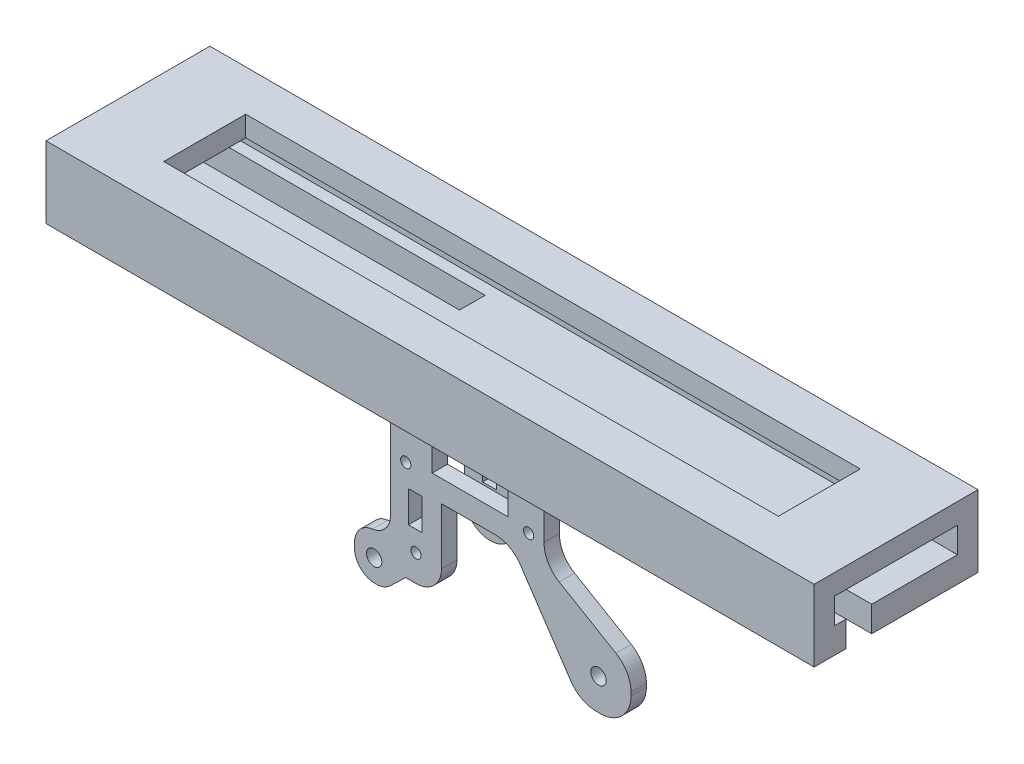
from build123d import *

# Parameters (mm, degrees)
SKETCH1_W            = 150
SKETCH1_H            = 32
BOSS_EXTRUDE1_DEPTH  = 5
SKETCH2_W            = 150
SKETCH2_H            = 4
BOSS_EXTRUDE2_DEPTH  = 9
SKETCH4_W            = 4
SKETCH4_H            = 4
BOSS_EXTRUDE3_DEPTH  = 150
SKETCH5_W            = 60
SKETCH5_H            = 5
CUT_EXTRUDE1_DEPTH   = 6
BOSS_EXTRUDE4_REACH  = 154.552
SKETCH6_W            = 15
SKETCH6_H            = 4
SKETCH7_W            = 60
SKETCH7_H            = 5
CUT_EXTRUDE2_DEPTH   = 6
SKETCH8_W            = 30
SKETCH8_H            = 3
BOSS_EXTRUDE5_DEPTH  = 16
SKETCH9_R            = 1
CUT_EXTRUDE3_DEPTH   = 153.867794188
SKETCH11_W           = 10
SKETCH11_H           = 3
BOSS_EXTRUDE7_DEPTH  = 16
SKETCH12_R           = 1
CUT_EXTRUDE4_DEPTH   = 156.359462216
SKETCH13_W           = 20
SKETCH13_H           = 3
BOSS_EXTRUDE8_DEPTH  = 20
SKETCH14_W           = 10
SKETCH14_H           = 3
BOSS_EXTRUDE9_DEPTH  = 4
SKETCH15_W           = 7
SKETCH15_H           = 3
BOSS_EXTRUDE10_DEPTH = 5
SKETCH16_R           = 1.5
CUT_EXTRUDE5_DEPTH   = 157.232399009
CUT_EXTRUDE6_DEPTH   = 5
CUT_EXTRUDE7_DEPTH   = 5
BOSS_EXTRUDE11_DEPTH = 3
CUT_EXTRUDE8_DEPTH   = 3
SKETCH21_W           = 14.847248178
SKETCH21_H           = 8.269274671
CUT_EXTRUDE9_DEPTH   = 157.232399009
FILLET3_R            = 6
FILLET4_R            = 4
FILLET5_R            = 5
FILLET6_R            = 5
SKETCH22_W           = 2.686432883
SKETCH22_H           = 6.135326584
CUT_EXTRUDE10_DEPTH  = 157.232399009
FILLET7_R            = 6
FILLET8_R            = 6
FILLET9_R            = 4
FILLET10_R           = 1
FILLET11_R           = 1


with BuildPart() as part:
    # Sketch1 → Boss-Extrude1 (new body)
    with BuildSketch(Plane(origin=(0, 0, 0), x_dir=(1, 0, 0), z_dir=(0, 1, 0))):
        with Locations((75, -16)):
            Rectangle(SKETCH1_W, SKETCH1_H)
    extrude(amount=BOSS_EXTRUDE1_DEPTH)

    # Sketch2 → Boss-Extrude2 (add)
    with BuildSketch(Plane(origin=(0, 5, 0), x_dir=(1, 0, 0), z_dir=(0, 1, 0))):
        with Locations((75, -30)):
            Rectangle(SKETCH2_W, SKETCH2_H)
        with Locations((75, -2)):
            Rectangle(SKETCH2_W, SKETCH2_H)
    extrude(amount=BOSS_EXTRUDE2_DEPTH)

    # Sketch4 → Boss-Extrude3 (add)
    with BuildSketch(Plane.ZY):
        with Locations((6, 12)):
            Rectangle(SKETCH4_W, SKETCH4_H)
        with Locations((26, 12)):
            Rectangle(SKETCH4_W, SKETCH4_H)
    extrude(amount=-BOSS_EXTRUDE3_DEPTH)

    # Sketch5 → Cut-Extrude1 (cut)
    with BuildSketch(Plane(origin=(0, 0, 0), x_dir=(-1, 0, 0), z_dir=(0, -1, 0))):
        with Locations((-120, -23.25)):
            Rectangle(SKETCH5_W, SKETCH5_H)
    extrude(amount=-CUT_EXTRUDE1_DEPTH, mode=Mode.SUBTRACT)

    # Sketch6 → Boss-Extrude4 (add, up to next)
    with BuildSketch(Plane(origin=(0, 0, 24), x_dir=(-1, 0, 0), z_dir=(0, 0, -1)), mode=Mode.PRIVATE) as boss_extrude4_sk1:
        with Locations((-142.5, 12)):
            Rectangle(SKETCH6_W, SKETCH6_H)
    boss_extrude4_tool1 = extrude(boss_extrude4_sk1.sketch, amount=BOSS_EXTRUDE4_REACH, mode=Mode.PRIVATE) - part.part
    # Sketch6 → Boss-Extrude4 (add, up to next)
    with BuildSketch(Plane(origin=(0, 0, 24), x_dir=(-1, 0, 0), z_dir=(0, 0, -1)), mode=Mode.PRIVATE) as boss_extrude4_sk2:
        with Locations((-7.5, 12)):
            Rectangle(SKETCH6_W, SKETCH6_H)
    boss_extrude4_tool2 = extrude(boss_extrude4_sk2.sketch, amount=BOSS_EXTRUDE4_REACH, mode=Mode.PRIVATE) - part.part
    add(boss_extrude4_tool1.solids().sort_by_distance((142.5, 12, 24))[0])
    add(boss_extrude4_tool2.solids().sort_by_distance((7.5, 12, 24))[0])

    # Sketch7 → Cut-Extrude2 (cut)
    with BuildSketch(Plane(origin=(0, 0, 0), x_dir=(-1, 0, 0), z_dir=(0, -1, 0))):
        with Locations((-30, -8.75)):
            Rectangle(SKETCH7_W, SKETCH7_H)
    extrude(amount=-CUT_EXTRUDE2_DEPTH, mode=Mode.SUBTRACT)

    # Sketch8 → Boss-Extrude5 (add)
    with BuildSketch(Plane.XZ):
        with Locations((75, 23.25)):
            Rectangle(SKETCH8_W, SKETCH8_H)
        with Locations((75, 8.75)):
            Rectangle(SKETCH8_W, SKETCH8_H)
    extrude(amount=BOSS_EXTRUDE5_DEPTH)

    # Sketch9 → Cut-Extrude3 (cut, through all)
    with BuildSketch(Plane(origin=(0, 0, 7.25), x_dir=(-1, 0, 0), z_dir=(0, 0, -1))):
        with Locations((-63, -12.5)):
            Circle(SKETCH9_R)
        with Locations((-87, -12.5)):
            Circle(SKETCH9_R)
    extrude(amount=-CUT_EXTRUDE3_DEPTH, mode=Mode.SUBTRACT)

    # Sketch11 → Boss-Extrude7 (add)
    with BuildSketch(Plane(origin=(0, -16, 0), x_dir=(-1, 0, 0), z_dir=(0, -1, 0))):
        with Locations((-65, -8.75)):
            Rectangle(SKETCH11_W, SKETCH11_H)
        with Locations((-65, -23.25)):
            Rectangle(SKETCH11_W, SKETCH11_H)
    extrude(amount=BOSS_EXTRUDE7_DEPTH)

    # Sketch12 → Cut-Extrude4 (cut, through all)
    with BuildSketch(Plane.XY.offset(24.75)):
        with Locations((65, -26.8)):
            Circle(SKETCH12_R)
    extrude(amount=-CUT_EXTRUDE4_DEPTH, mode=Mode.SUBTRACT)

    # Sketch13 → Boss-Extrude8 (add)
    with BuildSketch(Plane(origin=(0, -16, 0), x_dir=(-1, 0, 0), z_dir=(0, -1, 0))):
        with Locations((-97, -23.25)):
            Rectangle(SKETCH13_W, SKETCH13_H)
    extrude(amount=BOSS_EXTRUDE8_DEPTH)

    # Sketch14 → Boss-Extrude9 (add)
    with BuildSketch(Plane(origin=(0, -32, 0), x_dir=(-1, 0, 0), z_dir=(0, -1, 0))):
        with Locations((-58, -23.25)):
            Rectangle(SKETCH14_W, SKETCH14_H)
    extrude(amount=BOSS_EXTRUDE9_DEPTH)

    # Sketch15 → Boss-Extrude10 (add)
    with BuildSketch(Plane(origin=(0, -32, 0), x_dir=(1, 0, 0), z_dir=(0, 1, 0))):
        with Locations((56.5, -23.25)):
            Rectangle(SKETCH15_W, SKETCH15_H)
    extrude(amount=BOSS_EXTRUDE10_DEPTH)

    # Sketch16 → Cut-Extrude5 (cut, through all)
    with BuildSketch(Plane.XY.offset(24.75)):
        with Locations((56.830024482, -31.707497886)):
            Circle(SKETCH16_R)
        with Locations((100.640738332, -29.851736065)):
            Circle(SKETCH16_R)
    extrude(amount=-CUT_EXTRUDE5_DEPTH, mode=Mode.SUBTRACT)

    # Sketch17 → Cut-Extrude6 (cut)
    with BuildSketch(Plane.XY.offset(24.75)):
        Polygon((97, -36), (87, -21.056914339), (87, -36), align=None)
    extrude(amount=-CUT_EXTRUDE6_DEPTH, mode=Mode.SUBTRACT)

    # Sketch18 → Cut-Extrude7 (cut)
    with BuildSketch(Plane.XY.offset(24.75)):
        Polygon((107, -26), (90, -16), (107, -16), align=None)
    extrude(amount=-CUT_EXTRUDE7_DEPTH, mode=Mode.SUBTRACT)

    # Sketch19 → Boss-Extrude11 (add)
    with BuildSketch(Plane.XY.offset(24.75)):
        Polygon((87, -21.056914339), (83.615883457, -16), (87, -16), align=None)
    extrude(amount=-BOSS_EXTRUDE11_DEPTH)

    # Sketch20 → Cut-Extrude8 (cut)
    with BuildSketch(Plane.XY.offset(24.75)):
        Polygon((58.822210862, -36), (63, -32), (63, -36), align=None)
    extrude(amount=-CUT_EXTRUDE8_DEPTH, mode=Mode.SUBTRACT)

    # Sketch21 → Cut-Extrude9 (cut, through all)
    with BuildSketch(Plane(origin=(0, 0, 7.25), x_dir=(-1, 0, 0), z_dir=(0, 0, -1))):
        with Locations((-75.571857051, -7.603356602)):
            Rectangle(SKETCH21_W, SKETCH21_H)
    extrude(amount=-CUT_EXTRUDE9_DEPTH, mode=Mode.SUBTRACT)

    # Fillet3
    fillet3_edges = [part.edges().sort_by_distance(p)[0] for p in [
        (107, -36, 23.25),
        (97, -36, 23.25),
        (107, -26, 23.25),
    ]]
    fillet(fillet3_edges, radius=FILLET3_R)

    # Fillet4
    fillet4_edges = [part.edges().sort_by_distance(p)[0] for p in [
        (53, -36, 23.25),
        (53, -27, 23.25),
        (58.822210862, -36, 23.25),
    ]]
    fillet(fillet4_edges, radius=FILLET4_R)

    # Fillet5
    fillet5_edges = [part.edges().sort_by_distance(p)[0] for p in [
        (90, -16, 8.75),
        (70, -32, 8.75),
        (60, -32, 8.75),
    ]]
    fillet(fillet5_edges, radius=FILLET5_R - 0.0001)  # a hair under: the kernel refuses the full size

    # Fillet6
    fillet6_edges = [part.edges().sort_by_distance(p)[0] for p in [
        (70, -32, 23.25),
    ]]
    fillet(fillet6_edges, radius=FILLET6_R)

    # Sketch22 → Cut-Extrude10 (cut, through all)
    with BuildSketch(Plane(origin=(0, 0, 7.25), x_dir=(-1, 0, 0), z_dir=(0, 0, -1))):
        with Locations((-64.85928039, -19.744776936)):
            Rectangle(SKETCH22_W, SKETCH22_H)
    extrude(amount=-CUT_EXTRUDE10_DEPTH, mode=Mode.SUBTRACT)

    # Fillet7
    fillet7_edges = [part.edges().sort_by_distance(p)[0] for p in [
        (90, -16, 23.25),
    ]]
    fillet(fillet7_edges, radius=FILLET7_R)

    # Fillet8
    fillet8_edges = [part.edges().sort_by_distance(p)[0] for p in [
        (83.615883457, -16, 23.25),
    ]]
    fillet(fillet8_edges, radius=FILLET8_R)

    # Fillet9
    fillet9_edges = [part.edges().sort_by_distance(p)[0] for p in [
        (60, -27, 23.25),
    ]]
    fillet(fillet9_edges, radius=FILLET9_R)

    # Fillet10
    fillet10_edges = [part.edges().sort_by_distance(p)[0] for p in [
        (75, 0, 7.25),
    ]]
    fillet(fillet10_edges, radius=FILLET10_R)

    # Fillet11
    fillet11_edges = [part.edges().sort_by_distance(p)[0] for p in [
        (75, 0, 24.75),
    ]]
    fillet(fillet11_edges, radius=FILLET11_R)


solid = part.part
